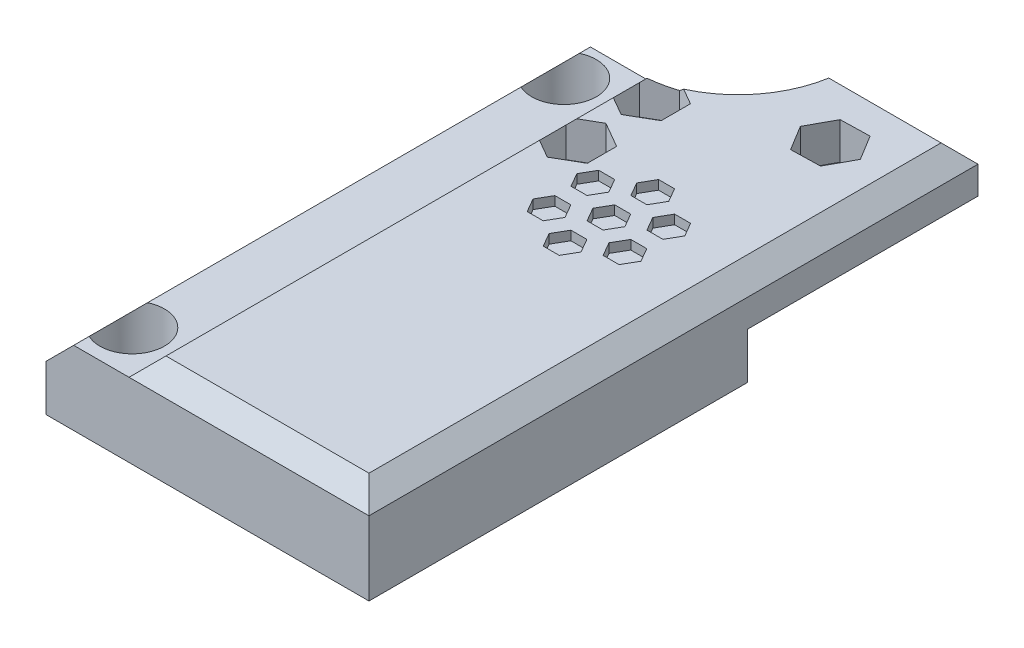
from build123d import *

# Parameters (mm, degrees)
SKETCH1_W           = 26
SKETCH1_H           = 41
BOSS_EXTRUDE1_DEPTH = 10
SKETCH2_W           = 26
SKETCH2_H           = 5
BOSS_EXTRUDE2_DEPTH = 25
CUT_EXTRUDE1_REACH  = 73.638
CHAMFER1_SIZE       = 2
SKETCH4_W           = 56
SKETCH4_H           = 8
BOSS_EXTRUDE3_DEPTH = 9
CUT_EXTRUDE2_REACH  = 73.386
SKETCH5_R           = 2.15
SKETCH6_R           = 3.5
CUT_EXTRUDE3_DEPTH  = 5
CHAMFER3_SIZE       = 3
CUT_EXTRUDE5_DEPTH  = 1
CUT_EXTRUDE6_DEPTH  = 4
CUT_EXTRUDE7_REACH  = 73.638
SKETCH12_R          = 1.65
SKETCH14_W          = 12
SKETCH14_H          = 12
CUT_EXTRUDE9_DEPTH  = 7


with BuildPart() as part:
    # Sketch1 → Boss-Extrude1 (new body)
    with BuildSketch(Plane(origin=(0, 0, 0), x_dir=(1, 0, 0), z_dir=(0, 1, 0))):
        with Locations((13, 20.5)):
            Rectangle(SKETCH1_W, SKETCH1_H)
    extrude(amount=BOSS_EXTRUDE1_DEPTH)

    # Sketch2 → Boss-Extrude2 (add)
    with BuildSketch(Plane(origin=(0, 0, -41), x_dir=(-1, 0, 0), z_dir=(0, 0, -1))):
        with Locations((-13, 7.5)):
            Rectangle(SKETCH2_W, SKETCH2_H)
    extrude(amount=BOSS_EXTRUDE2_DEPTH)

    # Sketch3 → Cut-Extrude1 (cut, up to next)
    with BuildSketch(Plane(origin=(0, 10, 0), x_dir=(1, 0, 0), z_dir=(0, 1, 0)), mode=Mode.PRIVATE) as cut_extrude1_sk1:
        with BuildLine():
            Line((0, 56), (0, 66))
            Line((0, 66), (10, 66))
            ThreePointArc((10, 66), (7.071067812, 58.928932188), (0, 56))
        make_face()
    cut_extrude1_tool1 = extrude(cut_extrude1_sk1.sketch, amount=-CUT_EXTRUDE1_REACH, mode=Mode.PRIVATE) & part.part
    add(cut_extrude1_tool1.solids().sort_by_distance((4.244132, 10, -61.755868))[0], mode=Mode.SUBTRACT)

    # Chamfer1
    chamfer1_edges = [part.edges().sort_by_distance(p)[0] for p in [
        (26, 10, -33),
        (18, 10, -66),
        (0, 10, -28),
        (7.071067812, 10, -58.928932188),
        (13, 10, 0),
    ]]
    chamfer(chamfer1_edges, length=CHAMFER1_SIZE)

    # Sketch4 → Boss-Extrude3 (add)
    with BuildSketch(Plane.ZY):
        with Locations((-28, 4)):
            Rectangle(SKETCH4_W, SKETCH4_H)
    extrude(amount=BOSS_EXTRUDE3_DEPTH)

    # Sketch5 → Cut-Extrude2 (cut, up to next)
    with BuildSketch(Plane(origin=(0, 8, 0), x_dir=(1, 0, 0), z_dir=(0, 1, 0)), mode=Mode.PRIVATE) as cut_extrude2_sk1:
        with Locations(Location((-4.5, 51.637478231, 0), (0, 0, 270))):
            Circle(SKETCH5_R)
    cut_extrude2_tool1 = extrude(cut_extrude2_sk1.sketch, amount=-CUT_EXTRUDE2_REACH, mode=Mode.PRIVATE) & part.part
    # Sketch5 → Cut-Extrude2 (cut, up to next)
    with BuildSketch(Plane(origin=(0, 8, 0), x_dir=(1, 0, 0), z_dir=(0, 1, 0)), mode=Mode.PRIVATE) as cut_extrude2_sk2:
        with Locations(Location((-4.5, 4.837478231, 0), (0, 0, 270))):
            Circle(SKETCH5_R)
    cut_extrude2_tool2 = extrude(cut_extrude2_sk2.sketch, amount=-CUT_EXTRUDE2_REACH, mode=Mode.PRIVATE) & part.part
    add(cut_extrude2_tool1.solids().sort_by_distance((-4.5, 8, -51.637478))[0], mode=Mode.SUBTRACT)
    add(cut_extrude2_tool2.solids().sort_by_distance((-4.5, 8, -4.837478))[0], mode=Mode.SUBTRACT)

    # Sketch6 → Cut-Extrude3 (cut)
    with BuildSketch(Plane(origin=(0, 8, 0), x_dir=(1, 0, 0), z_dir=(0, 1, 0))):
        with Locations(Location((-4.5, 51.637478231, 0), (0, 0, 270))):
            Circle(SKETCH6_R)
        with Locations(Location((-4.5, 4.837478231, 0), (0, 0, 270))):
            Circle(SKETCH6_R)
    extrude(amount=-CUT_EXTRUDE3_DEPTH, mode=Mode.SUBTRACT)

    # Chamfer3
    # the kernel refuses this chamfer: 3 mm, written as the material it takes off along each edge
    with BuildSketch(Plane(origin=(-9, 8, -63.715048964), x_dir=(-0.0274958766105862, -0.9996219169112968, 0), z_dir=(0, 0, 1))) as chamfer3_piece_1:
        Polygon((CHAMFER3_SIZE * 0.999621916911, CHAMFER3_SIZE * 0.0274958766106), (-CHAMFER3_SIZE * 0.0274958766106, CHAMFER3_SIZE * 0.999621916911), (0, 0), align=None)
    extrude(amount=71.430097928, mode=Mode.SUBTRACT)

    # Sketch10 → Cut-Extrude5 (cut)
    with BuildSketch(Plane(origin=(0, 10, 0), x_dir=(1, 0, 0), z_dir=(0, 1, 0))):
        Polygon((14.732050808, 39), (13.866025404, 40.5), (12.133974596, 40.5), (11.267949192, 39), (12.133974596, 37.5), (13.866025404, 37.5), align=None)
        Polygon((14.732050808, 43.75), (13.866025404, 45.25), (12.133974596, 45.25), (11.267949192, 43.75), (12.133974596, 42.25), (13.866025404, 42.25), align=None)
        Polygon((17.979646072, 39.875), (18.845671476, 41.375), (17.979646072, 42.875), (16.247595264, 42.875), (15.38156986, 41.375), (16.247595264, 39.875), align=None)
        Polygon((16.247595264, 35.125), (17.979646072, 35.125), (18.845671476, 36.625), (17.979646072, 38.125), (16.247595264, 38.125), (15.38156986, 36.625), align=None)
        Polygon((11.267949192, 34.25), (12.133974596, 32.75), (13.866025404, 32.75), (14.732050808, 34.25), (13.866025404, 35.75), (12.133974596, 35.75), align=None)
        Polygon((8.020353928, 38.125), (7.154328524, 36.625), (8.020353928, 35.125), (9.752404736, 35.125), (10.61843014, 36.625), (9.752404736, 38.125), align=None)
        Polygon((9.752404736, 42.875), (8.020353928, 42.875), (7.154328524, 41.375), (8.020353928, 39.875), (9.752404736, 39.875), (10.61843014, 41.375), align=None)
    extrude(amount=-CUT_EXTRUDE5_DEPTH, mode=Mode.SUBTRACT)

    # Sketch11 → Cut-Extrude6 (cut)
    with BuildSketch(Plane(origin=(0, 10, 0), x_dir=(1, 0, 0), z_dir=(0, 1, 0))):
        Polygon((6.75, 46.08771324), (4, 47.675426481), (1.25, 46.08771324), (1.25, 42.91228676), (4, 41.324573519), (6.75, 42.91228676), align=None)
        Polygon((6.75, 54.08771324), (4, 55.675426481), (1.25, 54.08771324), (1.25, 50.91228676), (4, 49.324573519), (6.75, 50.91228676), align=None)
        Polygon((21.174508901, 58.076331968), (19.521149027, 60.787371337), (16.346640126, 60.711039369), (14.825491099, 57.923668032), (16.478850973, 55.212628663), (19.653359874, 55.288960631), align=None)
    extrude(amount=-CUT_EXTRUDE6_DEPTH, mode=Mode.SUBTRACT)

    # Sketch12 → Cut-Extrude7 (cut, up to next)
    with BuildSketch(Plane(origin=(0, 10, 0), x_dir=(1, 0, 0), z_dir=(0, 1, 0)), mode=Mode.PRIVATE) as cut_extrude7_sk1:
        with Locations(Location((4, 52.5, 0), (0, 0, 270))):
            Circle(SKETCH12_R)
    cut_extrude7_tool1 = extrude(cut_extrude7_sk1.sketch, amount=-CUT_EXTRUDE7_REACH, mode=Mode.PRIVATE) & part.part
    # Sketch12 → Cut-Extrude7 (cut, up to next)
    with BuildSketch(Plane(origin=(0, 10, 0), x_dir=(1, 0, 0), z_dir=(0, 1, 0)), mode=Mode.PRIVATE) as cut_extrude7_sk2:
        with Locations(Location((4, 44.5, 0), (0, 0, 270))):
            Circle(SKETCH12_R)
    cut_extrude7_tool2 = extrude(cut_extrude7_sk2.sketch, amount=-CUT_EXTRUDE7_REACH, mode=Mode.PRIVATE) & part.part
    # Sketch12 → Cut-Extrude7 (cut, up to next)
    with BuildSketch(Plane(origin=(0, 10, 0), x_dir=(1, 0, 0), z_dir=(0, 1, 0)), mode=Mode.PRIVATE) as cut_extrude7_sk3:
        with Locations(Location((18, 58, 0), (0, 0, 270))):
            Circle(SKETCH12_R)
    cut_extrude7_tool3 = extrude(cut_extrude7_sk3.sketch, amount=-CUT_EXTRUDE7_REACH, mode=Mode.PRIVATE) & part.part
    add(cut_extrude7_tool1.solids().sort_by_distance((4, 10, -52.5))[0], mode=Mode.SUBTRACT)
    add(cut_extrude7_tool2.solids().sort_by_distance((4, 10, -44.5))[0], mode=Mode.SUBTRACT)
    add(cut_extrude7_tool3.solids().sort_by_distance((18, 10, -58))[0], mode=Mode.SUBTRACT)

    # Sketch14 → Cut-Extrude9 (cut)
    with BuildSketch(Plane.XZ):
        with Locations((18.75, -23)):
            Rectangle(SKETCH14_W, SKETCH14_H)
    extrude(amount=-CUT_EXTRUDE9_DEPTH, mode=Mode.SUBTRACT)


solid = part.part
